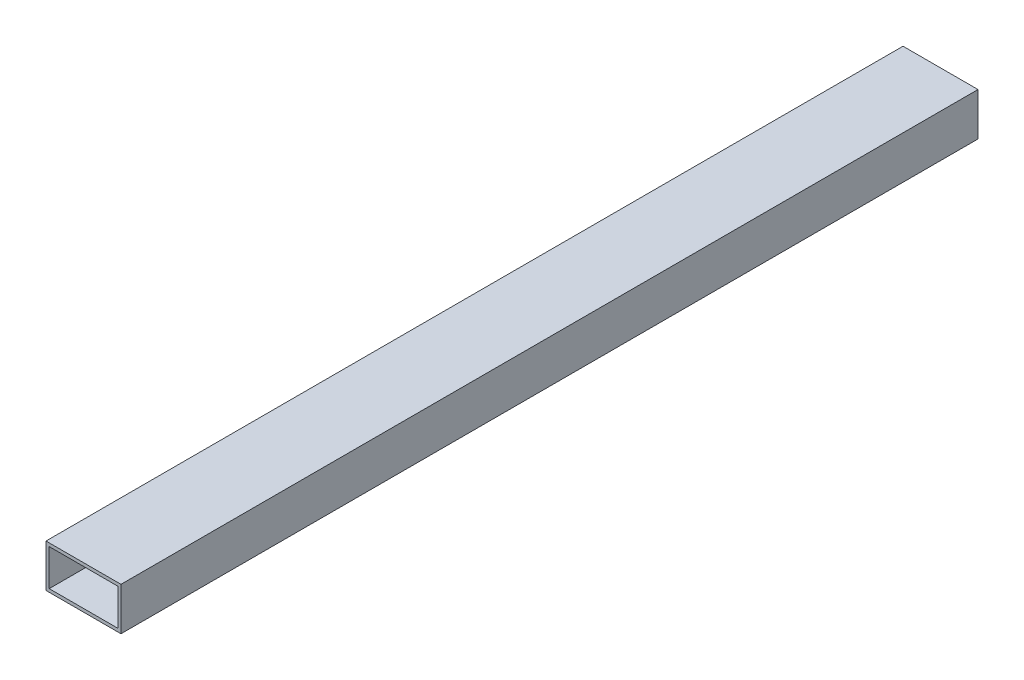
from build123d import *

# Parameters (mm, degrees)
ESQUISSE1_W        = 35
ESQUISSE1_H        = 20
ESQUISSE1_W_2      = 32
ESQUISSE1_H_2      = 17
BOSS_EXTRU_1_DEPTH = 400


with BuildPart() as part:
    # Esquisse1 → Boss.-Extru.1 (new body)
    with BuildSketch(Plane.XY):
        with Locations((17.5, 10)):
            Rectangle(ESQUISSE1_W, ESQUISSE1_H)
        with Locations((17.5, 10)):
            Rectangle(ESQUISSE1_W_2, ESQUISSE1_H_2, mode=Mode.SUBTRACT)
    extrude(amount=BOSS_EXTRU_1_DEPTH)


solid = part.part
